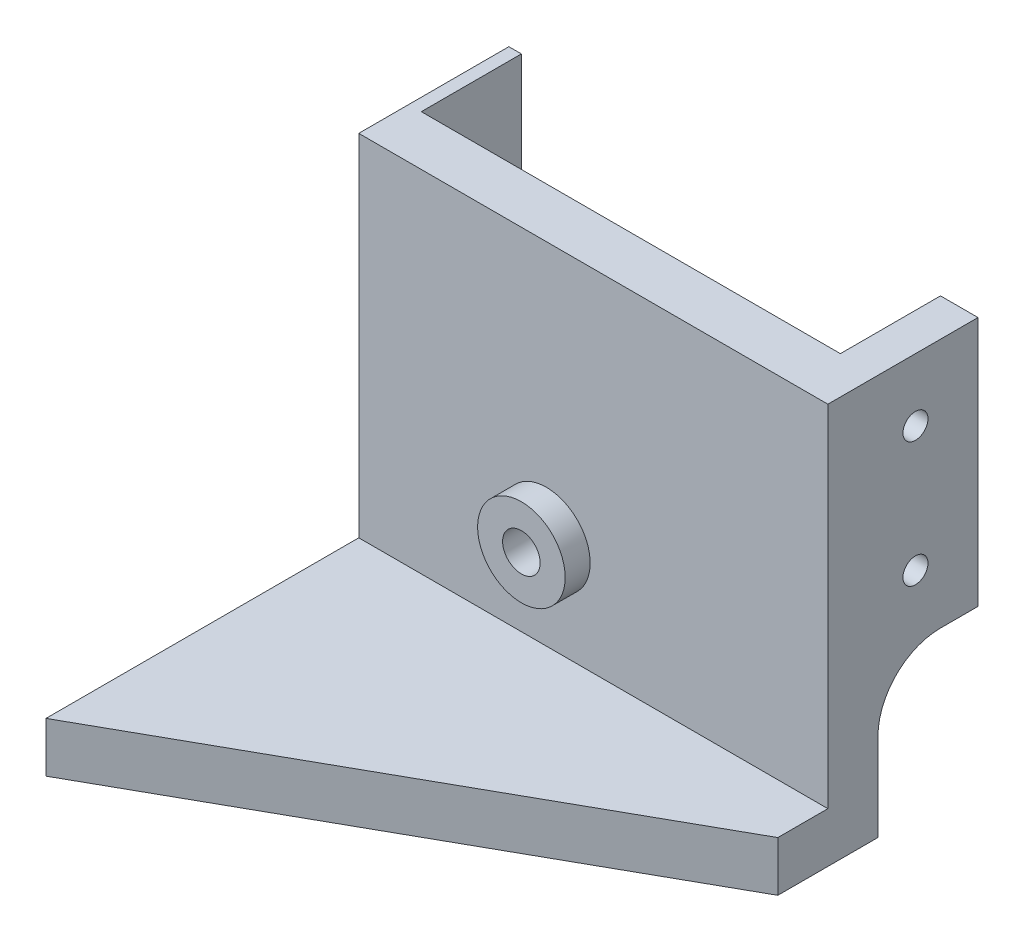
from build123d import *

# Parameters (mm, degrees)
BOSS_EXTRUDE1_DEPTH     = 20
SKETCH2_W               = 37.5
SKETCH2_H               = 4
BOSS_EXTRUDE2_DEPTH     = 12
FILLET1_R               = 5
SKETCH3_W               = 37.5
SKETCH3_H               = 4
BOSS_EXTRUDE3_DEPTH     = 25
SKETCH4_R               = 3.5
SKETCH4_R_2             = 1.5
BOSS_EXTRUDE4_DEPTH     = 2
SKETCH5_R               = 1.5
CUT_EXTRUDE1_DEPTH      = 49.324424466
CUT_EXTRUDE2_DEPTH      = 10
CUT_EXTRUDE3_DEPTH      = 50.307707308
CUT_EXTRUDE3_DEPTH_BACK = 50.307707308
SKETCH7_R               = 1


with BuildPart() as part:
    # Sketch1 → Boss-Extrude1 (new body)
    with BuildSketch(Plane(origin=(0, 0, 0), x_dir=(1, 0, 0), z_dir=(0, 1, 0))):
        Polygon((0, 12), (0, 0), (37.5, 0), (37.5, 12), (34.5, 12), (34.5, 4), (1, 4), (1, 12), align=None)
    extrude(amount=BOSS_EXTRUDE1_DEPTH)

    # Sketch2 → Boss-Extrude2 (add)
    with BuildSketch(Plane.XZ):
        with Locations((18.75, -2)):
            Rectangle(SKETCH2_W, SKETCH2_H)
    extrude(amount=BOSS_EXTRUDE2_DEPTH)

    # Fillet1
    fillet1_edges = [part.edges().sort_by_distance(p)[0] for p in [
        (0.5, 0, -4),
        (36, 0, -4),
    ]]
    fillet(fillet1_edges, radius=FILLET1_R)

    # Sketch3 → Boss-Extrude3 (add)
    with BuildSketch(Plane.XY):
        with Locations((18.75, -10)):
            Rectangle(SKETCH3_W, SKETCH3_H)
    extrude(amount=BOSS_EXTRUDE3_DEPTH)

    # Sketch4 → Boss-Extrude4 (add)
    with BuildSketch(Plane.XY):
        with Locations((15, -0.5)):
            Circle(SKETCH4_R)
        with Locations((15, -0.5)):
            Circle(SKETCH4_R_2, mode=Mode.SUBTRACT)
    extrude(amount=BOSS_EXTRUDE4_DEPTH)

    # Sketch5 → Cut-Extrude1 (cut, through all)
    with BuildSketch(Plane.XY.offset(2)):
        with Locations((15, -0.5)):
            Circle(SKETCH5_R)
    extrude(amount=-CUT_EXTRUDE1_DEPTH, mode=Mode.SUBTRACT)

    # Sketch6 → Cut-Extrude2 (cut)
    with BuildSketch(Plane(origin=(0, -8, 0), x_dir=(1, 0, 0), z_dir=(0, 1, 0))):
        Polygon((0, -25), (37.5, -4), (37.5, -25), align=None)
    extrude(amount=-CUT_EXTRUDE2_DEPTH, mode=Mode.SUBTRACT)

    # Sketch7 → Cut-Extrude3 (cut, two sides: drawn at the far end of the back side and taken through both)
    with BuildSketch(Plane.ZY.offset(-CUT_EXTRUDE3_DEPTH_BACK)):
        with Locations((-7, 15)):
            Circle(SKETCH7_R)
        with Locations((-7, 5)):
            Circle(SKETCH7_R)
    extrude(amount=CUT_EXTRUDE3_DEPTH + CUT_EXTRUDE3_DEPTH_BACK, mode=Mode.SUBTRACT)


solid = part.part
